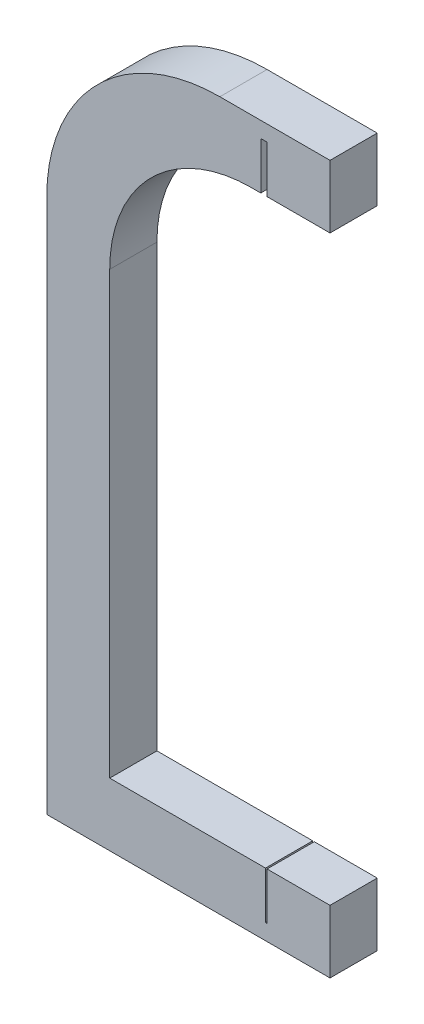
from build123d import *

# Parameters (mm, degrees)
BOSS_EXTRUDE1_DEPTH = 3
SKETCH3_W           = 0.1
SKETCH3_H           = 3
CUT_EXTRUDE1_DEPTH  = 3
SKETCH4_W           = 0.4
SKETCH4_H           = 3
CUT_EXTRUDE2_DEPTH  = 3


with BuildPart() as part:
    # Sketch1 → Boss-Extrude1 (new body)
    with BuildSketch(Plane.XY):
        with BuildLine():
            Line((0, 34), (0, 0))
            Line((0, 0), (18, 0))
            Line((18, 0), (18, 4))
            Line((18, 4), (4, 4))
            Line((4, 4), (4, 32))
            ThreePointArc((4, 32), (6.636038969, 38.363961031), (13, 41))
            Line((13, 41), (18, 41))
            Line((18, 41), (18, 45))
            Line((18, 45), (11, 45))
            ThreePointArc((11, 45), (3.221825407, 41.778174593), (0, 34))
        make_face()
    extrude(amount=BOSS_EXTRUDE1_DEPTH)

    # Sketch3 → Cut-Extrude1 (cut)
    with BuildSketch(Plane(origin=(0, 4, 0), x_dir=(1, 0, 0), z_dir=(0, 1, 0))):
        with Locations((13.95, -1.5)):
            Rectangle(SKETCH3_W, SKETCH3_H)
    extrude(amount=-CUT_EXTRUDE1_DEPTH, mode=Mode.SUBTRACT)

    # Sketch4 → Cut-Extrude2 (cut)
    with BuildSketch(Plane.XZ.offset(-41)):
        with Locations((13.8, 1.5)):
            Rectangle(SKETCH4_W, SKETCH4_H)
    extrude(amount=-CUT_EXTRUDE2_DEPTH, mode=Mode.SUBTRACT)


solid = part.part
